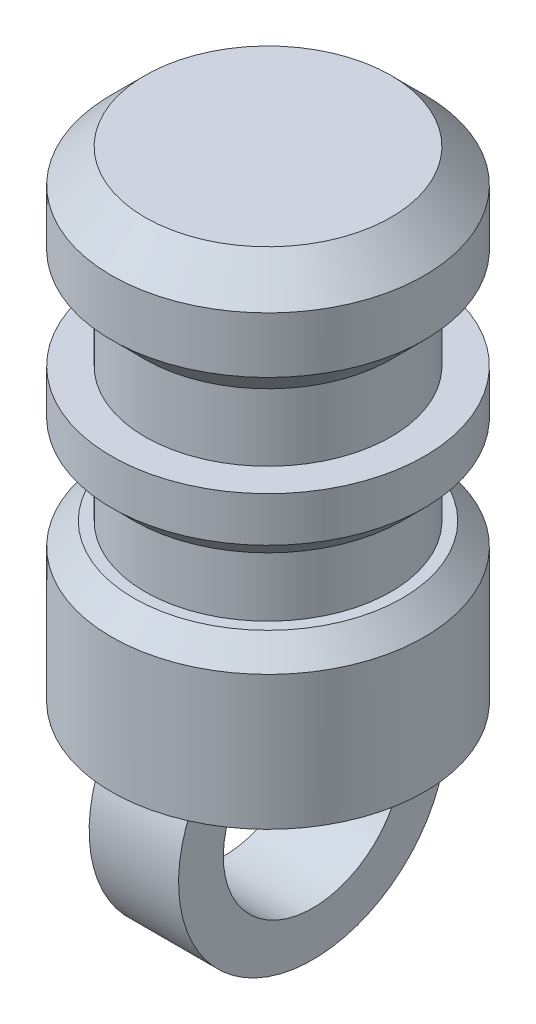
from build123d import *

# Parameters (mm, degrees)
CROQUIS1_W              = 36.7
CROQUIS1_H              = 40
CROQUIS1_R              = 4
SALIENTE_EXTRUIR1_DEPTH = 7
CHAFL_N1_SIZE           = 1
CROQUIS3_R              = 6.55
CORTAR_EXTRUIR1_DEPTH   = 2
CROQUIS5_W              = 36.7
CROQUIS5_H              = 7
CORTAR_EXTRUIR2_DEPTH   = 51.36836805
CROQUIS6_R              = 7
SALIENTE_EXTRUIR2_DEPTH = 2
SALIENTE_EXTRUIR3_START = 2
CROQUIS7_R              = 7
SALIENTE_EXTRUIR3_DEPTH = 2
SALIENTE_EXTRUIR4_DEPTH = 2
CHAFL_N2_SIZE           = 1.5


with BuildPart() as part:
    # Croquis1 → Saliente-Extruir1 (new body)
    with BuildSketch(Plane(origin=(0, 0, 0), x_dir=(1, 0, 0), z_dir=(0, 1, 0))):
        Rectangle(CROQUIS1_W, CROQUIS1_H)
        Circle(CROQUIS1_R, mode=Mode.SUBTRACT)
    extrude(amount=SALIENTE_EXTRUIR1_DEPTH)

    # Croquis2 → Revolución1 (revolve)
    with BuildSketch(Plane(origin=(0, 0, 0), x_dir=(0, 0, -1), z_dir=(1, 0, 0))):
        Polygon((7, 7), (7, 12), (5.5, 12), (5.5, 15), (7, 15), (7, 18), (5.5, 18), (5.5, 21), (7, 22.5), (7, 24.5), (4, 24.5), (4, 7), align=None)
    revolve(axis=Axis((0, 7, 0), (0, 1, 0)))

    # Chaflán1
    chafl_n1_edges = [part.edges().sort_by_distance(p)[0] for p in [
        (0, 12, 7),
        (0, 15, 7),
    ]]
    chamfer(chafl_n1_edges, length=CHAFL_N1_SIZE)

    # Croquis3 → Cortar-Extruir1 (cut)
    with BuildSketch(Plane.XZ):
        Circle(CROQUIS3_R)
    extrude(amount=-CORTAR_EXTRUIR1_DEPTH, mode=Mode.SUBTRACT)

    # Croquis5 → Cortar-Extruir2 (cut, through all)
    with BuildSketch(Plane.XY.offset(20)):
        with Locations((0, 3.5)):
            Rectangle(CROQUIS5_W, CROQUIS5_H)
    extrude(amount=-CORTAR_EXTRUIR2_DEPTH, mode=Mode.SUBTRACT)

    # Croquis6 → Saliente-Extruir2 (add)
    with BuildSketch(Plane.XZ.offset(-7)):
        Circle(CROQUIS6_R)
    extrude(amount=SALIENTE_EXTRUIR2_DEPTH)

    # Croquis7 → Saliente-Extruir3 (add)
    with BuildSketch(Plane(origin=(0, 24.5, 0), x_dir=(1, 0, 0), z_dir=(0, 1, 0)).offset(SALIENTE_EXTRUIR3_START)):
        Circle(CROQUIS7_R)
    extrude(amount=-SALIENTE_EXTRUIR3_DEPTH)

    # Croquis8 → Saliente-Extruir4 (add, symmetric)
    with BuildSketch(Plane(origin=(0, 0, 0), x_dir=(0, 0, -1), z_dir=(1, 0, 0))):
        with BuildLine():
            Line((-2.645751311, 5), (-5.196152423, 5))
            ThreePointArc((-5.196152423, 5), (0, -4), (5.196152423, 5))
            Line((5.196152423, 5), (2.645751311, 5))
            ThreePointArc((2.645751311, 5), (0, -2), (-2.645751311, 5))
        make_face()
    extrude(amount=SALIENTE_EXTRUIR4_DEPTH, both=True)

    # Chaflán2
    chafl_n2_edges = [part.edges().sort_by_distance(p)[0] for p in [
        (-7, 26.5, 0),
    ]]
    chamfer(chafl_n2_edges, length=CHAFL_N2_SIZE)


solid = part.part
